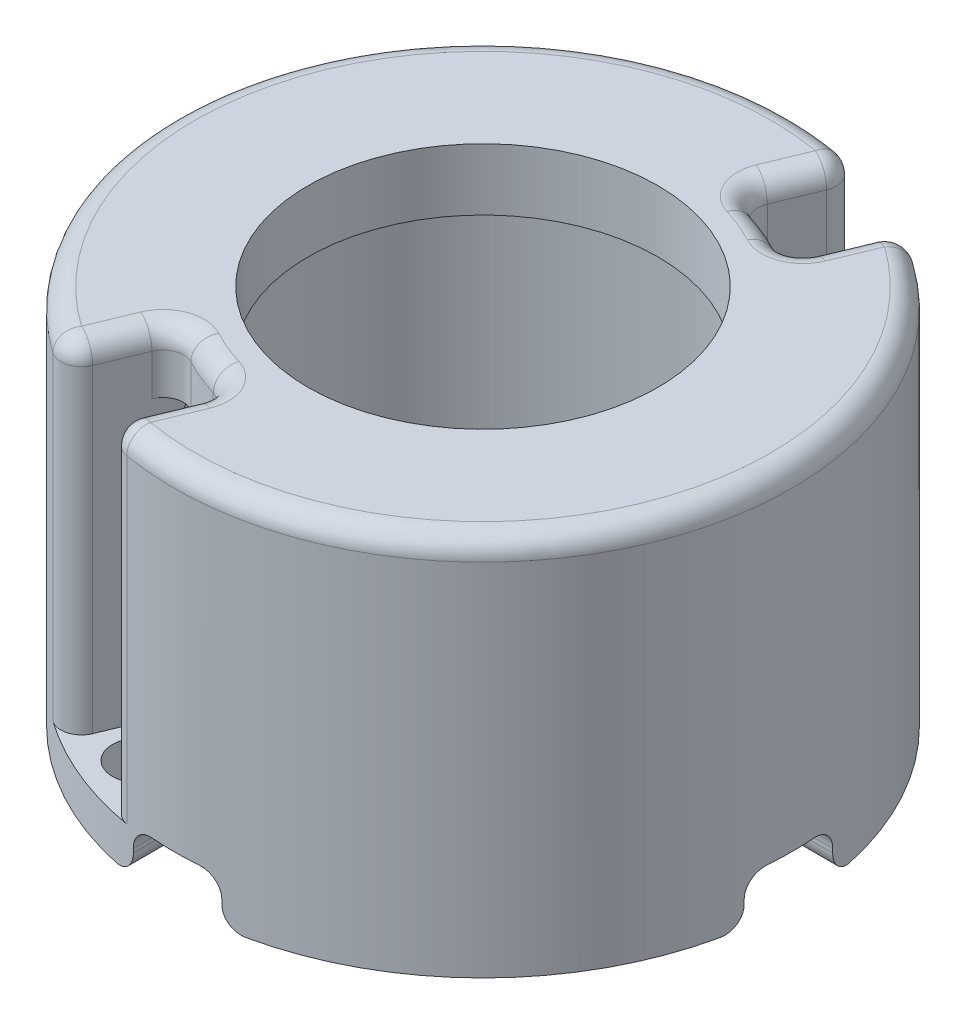
from build123d import *

# Parameters (mm, degrees)
SKETCH1_R                = 15
SKETCH1_R_2              = 10.5
BOSS_EXTRUDE1_DEPTH      = 18.5
CUT_EXTRUDE3_REACH       = 30.147
SKETCH6_R                = 1.35
SKETCH6_3_R              = 1.35
CUT_EXTRUDE4_DEPTH       = 16.5
BOSS_EXTRUDE2_START      = -3
SKETCH7_R                = 10.5
SKETCH7_R_2              = 8.5
BOSS_EXTRUDE2_DEPTH      = 3
FILLET1_R                = 1
CIRPATTERN3_START        = 2
CIRPATTERN3_DEPTH        = 16.5
CIRPATTERN3_2_OUTLINE_R  = 1.35
CIRPATTERN3_2_DEPTH      = 2
FILLET4_R                = 1
FILLET2_R                = 1
CUT_EXTRUDE5_DEPTH       = 2.2
FILLET3_R                = 1
CIRPATTERN2_COUNT        = 4
FILLET3_OF_CIRPATTERN2_R = 1
FILLET5_R                = 1


# Read off the part's stored shape, not the designer's step: CirPattern3
with BuildPart() as part:
    # Sketch1 → Boss-Extrude1 (new body)
    with BuildSketch(Plane(origin=(0, 0, 0), x_dir=(1, 0, 0), z_dir=(0, 1, 0))):
        with Locations(Location((0, 0, 0), (0, 0, 270))):
            Circle(SKETCH1_R)
        with Locations(Location((0, 0, 0), (0, 0, 270))):
            Circle(SKETCH1_R_2, mode=Mode.SUBTRACT)
    extrude(amount=BOSS_EXTRUDE1_DEPTH)

    # Sketch6 → Cut-Extrude3 (cut, up to next)
    with BuildSketch(Plane(origin=(0, 18.5, 0), x_dir=(1, 0, 0), z_dir=(0, 1, 0)), mode=Mode.PRIVATE) as cut_extrude3_sk1:
        with Locations(Location((4.879213763, 11.77946404, 0), (0, 0, 270))):
            Circle(SKETCH6_R)
    cut_extrude3_tool1 = extrude(cut_extrude3_sk1.sketch, amount=-CUT_EXTRUDE3_REACH, mode=Mode.PRIVATE) & part.part
    add(cut_extrude3_tool1.solids().sort_by_distance((4.879214, 18.5, -11.779464))[0], mode=Mode.SUBTRACT)

    # Sketch6<3> → Cut-Extrude4 (cut)
    # profile 1 of 2: a face of its own
    with BuildSketch(Plane(origin=(0, 18.5, 0), x_dir=(1, 0, 0), z_dir=(0, 1, 0))):
        with BuildLine():
            ThreePointArc((6.819360781, 10.975828832), (4.075578555, 9.839317021), (2.939066744, 12.583099247))
            Line((2.939066744, 12.583099247), (1.996845379, 10.308375649))
            Line((1.996845379, 10.308375649), (5.877139416, 8.701105234))
            Line((5.877139416, 8.701105234), (6.819360781, 10.975828832))
        make_face()
    # profile 2 of 2: a face of its own
    with BuildSketch(Plane(origin=(0, 18.5, 0), x_dir=(1, 0, 0), z_dir=(0, 1, 0))):
        with BuildLine():
            Line((3.800104467, 14.661828196), (2.939066744, 12.583099247))
            ThreePointArc((2.939066744, 12.583099247), (4.075578555, 9.839317021), (6.819360781, 10.975828832))
            Line((6.819360781, 10.975828832), (7.680398504, 13.05455778))
            Line((7.680398504, 13.05455778), (3.800104467, 14.661828196))
        make_face()
        with Locations(Location((4.879213763, 11.77946404, 0), (0, 0, 270))):
            Circle(SKETCH6_3_R, mode=Mode.SUBTRACT)
    extrude(amount=-CUT_EXTRUDE4_DEPTH, mode=Mode.SUBTRACT)

    # Sketch7 → Boss-Extrude2 (add)
    with BuildSketch(Plane(origin=(0, 18.5, 0), x_dir=(1, 0, 0), z_dir=(0, 1, 0)).offset(BOSS_EXTRUDE2_START)):
        with Locations(Location((0, 0, 0), (0, 0, 79.036959033))):
            Circle(SKETCH7_R)
        with Locations(Location((0, 0, 0), (0, 0, 270))):
            Circle(SKETCH7_R_2, mode=Mode.SUBTRACT)
    extrude(amount=BOSS_EXTRUDE2_DEPTH)

    # Fillet1
    fillet1_edges = [part.edges().sort_by_distance(p)[0] for p in [
        (3.743571621, 10.25, -14.525345831),
        (7.623865657, 10.25, -12.918075415),
        (5.877139416, 17, -8.701105234),
        (1.996845379, 17, -10.308375649),
    ]]
    fillet(fillet1_edges, radius=FILLET1_R)

    # CirPattern3 outline → CirPattern3 (cut)
    with BuildSketch(Plane(origin=(0, 0, 0), x_dir=(1, 0, 0), z_dir=(0, 1, 0)).offset(CIRPATTERN3_START)):
        with BuildLine():
            ThreePointArc((-1.996845379, -10.308375649), (-4.01817604, -9.700735091), (-5.877139416, -8.701105234))
            Line((-5.877139416, -8.701105234), (-7.16472198, -11.809604521))
            ThreePointArc((-7.16472198, -11.809604521), (-7.811227781, -12.387683189), (-8.666358763, -12.243129738))
            ThreePointArc((-8.666358763, -12.243129738), (-5.740251485, -13.858192988), (-2.529159011, -14.785241111))
            ThreePointArc((-2.529159011, -14.785241111), (-3.236042653, -14.282786919), (-3.284427943, -13.416874937))
            Line((-3.284427943, -13.416874937), (-1.996845379, -10.308375649))
        make_face()
    extrude(amount=CIRPATTERN3_DEPTH, mode=Mode.SUBTRACT)

    # CirPattern3 2 outline → CirPattern3 2 (cut)
    with BuildSketch(Plane(origin=(0, 0, 0), x_dir=(1, 0, 0), z_dir=(0, 1, 0))):
        with Locations((-4.879213763, -11.77946404)):
            Circle(CIRPATTERN3_2_OUTLINE_R)
    extrude(amount=CIRPATTERN3_2_DEPTH, mode=Mode.SUBTRACT)

    # Fillet4
    fillet4_edges = [part.edges().sort_by_distance(p)[0] for p in [
        (-5.877139416, 17, 8.701105234),
        (-1.996845379, 17, 10.308375649),
    ]]
    fillet(fillet4_edges, radius=FILLET4_R)

    # Fillet2
    fillet2_edges = [part.edges().sort_by_distance(p)[0] for p in [
        (14.294176193, 18.5, 4.547144924),
        (-3.236042653, 18.5, 14.282786919),
        (-7.811227781, 18.5, 12.387683189),
        (-4.01817604, 18.5, 9.700735091),
        (-2.862480829, 18.5, 12.398204493),
        (-6.742774866, 18.5, 10.790934077),
        (-2.459916629, 18.5, 10.570369824),
        (-5.734956453, 18.5, 9.213803913),
        (4.01817604, 18.5, -9.700735091),
        (2.86248083, 18.5, -12.398204493),
        (6.742774866, 18.5, -10.790934077),
        (-13.858192988, 18.5, -5.740251486),
        (3.236042653, 18.5, -14.28278692),
        (7.811227781, 18.5, -12.387683189),
        (2.45991663, 18.5, -10.570369825),
        (5.734956453, 18.5, -9.213803913),
    ]]
    fillet(fillet2_edges, radius=FILLET2_R)

    # Sketch8 → Cut-Extrude5 (cut)
    with BuildSketch(Plane.XZ):
        with BuildLine():
            Line((-2.15, 12.75), (-2.15, 15))
            Line((-2.15, 15), (2.15, 15))
            Line((2.15, 15), (2.15, 12.75))
            ThreePointArc((2.15, 12.75), (0, 10.6), (-2.15, 12.75))
        make_face()
    cut_extrude5 = extrude(amount=-CUT_EXTRUDE5_DEPTH, mode=Mode.SUBTRACT)

    # Fillet3
    # the kernel refuses this fillet: 1 mm, written as the material it adds along each edge
    with BuildSketch(Plane(origin=(-2.15, 2.2, 12.75), x_dir=(1, 0, 0), z_dir=(0, 0, 1))) as fillet3_piece_1_section:
        with BuildLine():
            CenterArc((FILLET3_R, -FILLET3_R), FILLET3_R, 90, 90)
            Line((0, -FILLET3_R), (0, 0))
            Line((0, 0), (FILLET3_R, 0))
        make_face()
    fillet3_piece_1 = extrude(amount=4.595117042, mode=Mode.PRIVATE)
    fillet3_piece_1 = fillet3_piece_1 & Plane(origin=(0, 1.975216442, 0), x_dir=(0, 0, 1), z_dir=(0, -1, 0)) * Cylinder(15, 14, mode=Mode.PRIVATE)
    add(fillet3_piece_1)
    with BuildSketch(Plane(origin=(2.15, 2.2, 17.345117042), x_dir=(-1, 0, 0), z_dir=(0, 0, -1))) as fillet3_piece_2_section:
        with BuildLine():
            CenterArc((FILLET3_R, -FILLET3_R), FILLET3_R, 90, 90)
            Line((0, -FILLET3_R), (0, 0))
            Line((0, 0), (FILLET3_R, 0))
        make_face()
    fillet3_piece_2 = extrude(amount=4.595117042, mode=Mode.PRIVATE)
    fillet3_piece_2 = fillet3_piece_2 & Plane(origin=(0, 1.975216442, 0), x_dir=(0, 0, 1), z_dir=(0, -1, 0)) * Cylinder(15, 14, mode=Mode.PRIVATE)
    add(fillet3_piece_2)
    with BuildSketch(Plane(origin=(0, 2.2, 12.75), x_dir=(1, 0, 0), z_dir=(0, 0, 1))) as fillet3_piece_3:
        with BuildLine():
            CenterArc((2.15 - FILLET3_R, -FILLET3_R), FILLET3_R, 0, 90)
            Line((2.15, -FILLET3_R), (2.15, 0))
            Line((2.15, 0), (2.15 - FILLET3_R, 0))
        make_face()
    revolve(axis=Axis((0, 2.2, 12.75), (0, 1, 0)), revolution_arc=180)
    # the kernel refuses this fillet: 1 mm, written as the material it takes off along each edge
    with BuildSketch(Plane(origin=(-2.15, 0, 12.75), x_dir=(-1, 0, 0), z_dir=(0, 0, 1))) as fillet3_2_piece_1:
        with BuildLine():
            CenterArc((FILLET3_R, -FILLET3_R), FILLET3_R, 90, 90)
            Line((0, -FILLET3_R), (0, 0))
            Line((0, 0), (FILLET3_R, 0))
        make_face()
    extrude(amount=4.595117042, mode=Mode.SUBTRACT)
    with BuildSketch(Plane(origin=(2.15, 0, 17.345117042), x_dir=(0, 1, 0), z_dir=(0, 0, -1))) as fillet3_2_piece_2:
        with BuildLine():
            CenterArc((FILLET3_R, FILLET3_R), FILLET3_R, 180, 90)
            Line((0, FILLET3_R), (0, 0))
            Line((0, 0), (FILLET3_R, 0))
        make_face()
    extrude(amount=4.595117042, mode=Mode.SUBTRACT)
    with BuildSketch(Plane(origin=(0, 0, 12.75), x_dir=(1, 0, 0), z_dir=(0, 0, 1))) as fillet3_2_piece_3:
        with BuildLine():
            CenterArc((2.15 + FILLET3_R, FILLET3_R), FILLET3_R, 180, 90)
            Line((2.15, FILLET3_R), (2.15, 0))
            Line((2.15, 0), (2.15 + FILLET3_R, 0))
        make_face()
    revolve(axis=Axis((0, 0, 12.75), (0, 1, 0)), revolution_arc=180, mode=Mode.SUBTRACT)

    # CirPattern2: Cut-Extrude5 ×4 about axis
    cirpattern2_axis = Axis((0, 0, 0), (0, 1, 0))
    for i in range(1, CIRPATTERN2_COUNT):
        add(cut_extrude5.rotate(cirpattern2_axis, i * 360 / CIRPATTERN2_COUNT), mode=Mode.SUBTRACT)

    # Fillet3 of CirPattern2
    # the kernel refuses this fillet: 1 mm, written as the material it adds along each edge
    with BuildSketch(Plane(origin=(12.75, 2.2, 2.15), x_dir=(0, -1, 0), z_dir=(1, 0, 0))) as fillet3_of_cirpattern2_piece_1_section:
        with BuildLine():
            CenterArc((FILLET3_OF_CIRPATTERN2_R, FILLET3_OF_CIRPATTERN2_R), FILLET3_OF_CIRPATTERN2_R, 180, 90)
            Line((0, FILLET3_OF_CIRPATTERN2_R), (0, 0))
            Line((0, 0), (FILLET3_OF_CIRPATTERN2_R, 0))
        make_face()
    fillet3_of_cirpattern2_piece_1 = extrude(amount=4.595117042, mode=Mode.PRIVATE)
    fillet3_of_cirpattern2_piece_1 = fillet3_of_cirpattern2_piece_1 & Plane(origin=(0, 1.975216412, 0), x_dir=(0, 0, 1), z_dir=(0, -1, 0)) * Cylinder(15, 14, mode=Mode.PRIVATE)
    add(fillet3_of_cirpattern2_piece_1)
    with BuildSketch(Plane(origin=(17.345117042, 2.2, -2.15), x_dir=(0, 0, 1), z_dir=(-1, 0, 0))) as fillet3_of_cirpattern2_piece_2_section:
        with BuildLine():
            CenterArc((FILLET3_OF_CIRPATTERN2_R, -FILLET3_OF_CIRPATTERN2_R), FILLET3_OF_CIRPATTERN2_R, 90, 90)
            Line((0, -FILLET3_OF_CIRPATTERN2_R), (0, 0))
            Line((0, 0), (FILLET3_OF_CIRPATTERN2_R, 0))
        make_face()
    fillet3_of_cirpattern2_piece_2 = extrude(amount=4.595117042, mode=Mode.PRIVATE)
    fillet3_of_cirpattern2_piece_2 = fillet3_of_cirpattern2_piece_2 & Plane(origin=(0, 1.975216442, 0), x_dir=(0, 0, 1), z_dir=(0, -1, 0)) * Cylinder(15, 14, mode=Mode.PRIVATE)
    add(fillet3_of_cirpattern2_piece_2)
    with BuildSketch(Plane(origin=(12.75, 2.2, 0), x_dir=(0, 0, -1), z_dir=(1, 0, 0))) as fillet3_of_cirpattern2_piece_3:
        with BuildLine():
            CenterArc((2.15 - FILLET3_OF_CIRPATTERN2_R, -FILLET3_OF_CIRPATTERN2_R), FILLET3_OF_CIRPATTERN2_R, 0, 90)
            Line((2.15 - FILLET3_OF_CIRPATTERN2_R, 0), (2.15, 0))
            Line((2.15, 0), (2.15, -FILLET3_OF_CIRPATTERN2_R))
        make_face()
    revolve(axis=Axis((12.75, 2.2, 0), (0, 1, 0)), revolution_arc=180)
    with BuildSketch(Plane(origin=(2.15, 2.2, -12.75), x_dir=(0, -1, 0), z_dir=(0, 0, -1))) as fillet3_of_cirpattern2_piece_4_section:
        with BuildLine():
            CenterArc((FILLET3_OF_CIRPATTERN2_R, FILLET3_OF_CIRPATTERN2_R), FILLET3_OF_CIRPATTERN2_R, 180, 90)
            Line((0, FILLET3_OF_CIRPATTERN2_R), (0, 0))
            Line((0, 0), (FILLET3_OF_CIRPATTERN2_R, 0))
        make_face()
    fillet3_of_cirpattern2_piece_4 = extrude(amount=4.595117042, mode=Mode.PRIVATE)
    fillet3_of_cirpattern2_piece_4 = fillet3_of_cirpattern2_piece_4 & Plane(origin=(0, 1.975216412, 0), x_dir=(0, 0, 1), z_dir=(0, -1, 0)) * Cylinder(15, 14, mode=Mode.PRIVATE)
    add(fillet3_of_cirpattern2_piece_4)
    with BuildSketch(Plane(origin=(-2.15, 2.2, -17.345117042), x_dir=(1, 0, 0), z_dir=(0, 0, 1))) as fillet3_of_cirpattern2_piece_5_section:
        with BuildLine():
            CenterArc((FILLET3_OF_CIRPATTERN2_R, -FILLET3_OF_CIRPATTERN2_R), FILLET3_OF_CIRPATTERN2_R, 90, 90)
            Line((0, -FILLET3_OF_CIRPATTERN2_R), (0, 0))
            Line((0, 0), (FILLET3_OF_CIRPATTERN2_R, 0))
        make_face()
    fillet3_of_cirpattern2_piece_5 = extrude(amount=4.595117042, mode=Mode.PRIVATE)
    fillet3_of_cirpattern2_piece_5 = fillet3_of_cirpattern2_piece_5 & Plane(origin=(0, 1.975216442, 0), x_dir=(0, 0, 1), z_dir=(0, -1, 0)) * Cylinder(15, 14, mode=Mode.PRIVATE)
    add(fillet3_of_cirpattern2_piece_5)
    with BuildSketch(Plane(origin=(0, 2.2, -12.75), x_dir=(-1, 0, 0), z_dir=(0, 0, -1))) as fillet3_of_cirpattern2_piece_6:
        with BuildLine():
            CenterArc((2.15 - FILLET3_OF_CIRPATTERN2_R, -FILLET3_OF_CIRPATTERN2_R), FILLET3_OF_CIRPATTERN2_R, 0, 90)
            Line((2.15 - FILLET3_OF_CIRPATTERN2_R, 0), (2.15, 0))
            Line((2.15, 0), (2.15, -FILLET3_OF_CIRPATTERN2_R))
        make_face()
    revolve(axis=Axis((0, 2.2, -12.75), (0, 1, 0)), revolution_arc=180)
    with BuildSketch(Plane(origin=(-12.75, 2.2, -2.15), x_dir=(0, -1, 0), z_dir=(-1, 0, 0))) as fillet3_of_cirpattern2_piece_7_section:
        with BuildLine():
            CenterArc((FILLET3_OF_CIRPATTERN2_R, FILLET3_OF_CIRPATTERN2_R), FILLET3_OF_CIRPATTERN2_R, 180, 90)
            Line((0, FILLET3_OF_CIRPATTERN2_R), (0, 0))
            Line((0, 0), (FILLET3_OF_CIRPATTERN2_R, 0))
        make_face()
    fillet3_of_cirpattern2_piece_7 = extrude(amount=4.595117042, mode=Mode.PRIVATE)
    fillet3_of_cirpattern2_piece_7 = fillet3_of_cirpattern2_piece_7 & Plane(origin=(0, 1.975216578, 0), x_dir=(0, 0, 1), z_dir=(0, -1, 0)) * Cylinder(15, 14, mode=Mode.PRIVATE)
    add(fillet3_of_cirpattern2_piece_7)
    with BuildSketch(Plane(origin=(-17.345117042, 2.2, 2.15), x_dir=(0, 0, -1), z_dir=(1, 0, 0))) as fillet3_of_cirpattern2_piece_8_section:
        with BuildLine():
            CenterArc((FILLET3_OF_CIRPATTERN2_R, -FILLET3_OF_CIRPATTERN2_R), FILLET3_OF_CIRPATTERN2_R, 90, 90)
            Line((0, -FILLET3_OF_CIRPATTERN2_R), (0, 0))
            Line((0, 0), (FILLET3_OF_CIRPATTERN2_R, 0))
        make_face()
    fillet3_of_cirpattern2_piece_8 = extrude(amount=4.595117042, mode=Mode.PRIVATE)
    fillet3_of_cirpattern2_piece_8 = fillet3_of_cirpattern2_piece_8 & Plane(origin=(0, 1.975216442, 0), x_dir=(0, 0, 1), z_dir=(0, -1, 0)) * Cylinder(15, 14, mode=Mode.PRIVATE)
    add(fillet3_of_cirpattern2_piece_8)
    with BuildSketch(Plane(origin=(-12.75, 2.2, 0), x_dir=(0, 0, 1), z_dir=(-1, 0, 0))) as fillet3_of_cirpattern2_piece_9:
        with BuildLine():
            CenterArc((2.15 - FILLET3_OF_CIRPATTERN2_R, -FILLET3_OF_CIRPATTERN2_R), FILLET3_OF_CIRPATTERN2_R, 0, 90)
            Line((2.15 - FILLET3_OF_CIRPATTERN2_R, 0), (2.15, 0))
            Line((2.15, 0), (2.15, -FILLET3_OF_CIRPATTERN2_R))
        make_face()
    revolve(axis=Axis((-12.75, 2.2, 0), (0, 1, 0)), revolution_arc=180)
    # the kernel refuses this fillet: 1 mm, written as the material it takes off along each edge
    with BuildSketch(Plane(origin=(12.75, 0, 2.15), x_dir=(0, 0, 1), z_dir=(1, 0, 0)), Plane(origin=(17.345117042, 0, -2.15), x_dir=(0, 0, -1), z_dir=(-1, 0, 0)), Plane(origin=(2.15, 0, -12.75), x_dir=(1, 0, 0), z_dir=(0, 0, -1)), Plane(origin=(-2.15, 0, -17.345117042), x_dir=(-1, 0, 0), z_dir=(0, 0, 1)), Plane(origin=(-12.75, 0, -2.15), x_dir=(0, 0, -1), z_dir=(-1, 0, 0)), Plane(origin=(-17.345117042, 0, 2.15), x_dir=(0, 0, 1), z_dir=(1, 0, 0))) as fillet3_of_cirpattern2_2_piece_1:
        with BuildLine():
            CenterArc((FILLET3_OF_CIRPATTERN2_R, -FILLET3_OF_CIRPATTERN2_R), FILLET3_OF_CIRPATTERN2_R, 90, 90)
            Line((0, -FILLET3_OF_CIRPATTERN2_R), (0, 0))
            Line((0, 0), (FILLET3_OF_CIRPATTERN2_R, 0))
        make_face()
    extrude(amount=4.595117042, mode=Mode.SUBTRACT)
    with BuildSketch(Plane(origin=(12.75, 0, 0), x_dir=(0, 0, -1), z_dir=(1, 0, 0))) as fillet3_of_cirpattern2_2_piece_2:
        with BuildLine():
            CenterArc((2.15 + FILLET3_OF_CIRPATTERN2_R, FILLET3_OF_CIRPATTERN2_R), FILLET3_OF_CIRPATTERN2_R, 180, 90)
            Line((2.15, FILLET3_OF_CIRPATTERN2_R), (2.15, 0))
            Line((2.15, 0), (2.15 + FILLET3_OF_CIRPATTERN2_R, 0))
        make_face()
    revolve(axis=Axis((12.75, 0, 0), (0, 1, 0)), revolution_arc=180, mode=Mode.SUBTRACT)
    with BuildSketch(Plane(origin=(0, 0, -12.75), x_dir=(-1, 0, 0), z_dir=(0, 0, -1))) as fillet3_of_cirpattern2_2_piece_3:
        with BuildLine():
            CenterArc((2.15 + FILLET3_OF_CIRPATTERN2_R, FILLET3_OF_CIRPATTERN2_R), FILLET3_OF_CIRPATTERN2_R, 180, 90)
            Line((2.15, FILLET3_OF_CIRPATTERN2_R), (2.15, 0))
            Line((2.15, 0), (2.15 + FILLET3_OF_CIRPATTERN2_R, 0))
        make_face()
    revolve(axis=Axis((0, 0, -12.75), (0, 1, 0)), revolution_arc=180, mode=Mode.SUBTRACT)
    with BuildSketch(Plane(origin=(-12.75, 0, 0), x_dir=(0, 0, 1), z_dir=(-1, 0, 0))) as fillet3_of_cirpattern2_2_piece_4:
        with BuildLine():
            CenterArc((2.15 + FILLET3_OF_CIRPATTERN2_R, FILLET3_OF_CIRPATTERN2_R), FILLET3_OF_CIRPATTERN2_R, 180, 90)
            Line((2.15, FILLET3_OF_CIRPATTERN2_R), (2.15, 0))
            Line((2.15, 0), (2.15 + FILLET3_OF_CIRPATTERN2_R, 0))
        make_face()
    revolve(axis=Axis((-12.75, 0, 0), (0, 1, 0)), revolution_arc=180, mode=Mode.SUBTRACT)

    # Fillet5
    # the kernel refuses this fillet: 1 mm, written as the material it adds along each edge
    with BuildSketch(Plane(origin=(0, 15.5, 0), x_dir=(0.4166229549583832, 0, -0.9090793768432683), z_dir=(0.9090793768432683, 0, 0.4166229549583832))) as fillet5_piece_1_section:
        with BuildLine():
            CenterArc((10.5 - FILLET5_R, -FILLET5_R), FILLET5_R, 0, 90)
            Line((10.5 - FILLET5_R, 0), (10.5 - FILLET5_R, FILLET5_R * 0.02))
            Line((10.5 - FILLET5_R, FILLET5_R * 0.02), (10.5 + FILLET5_R * 0.02, FILLET5_R * 0.02))
            Line((10.5 + FILLET5_R * 0.02, FILLET5_R * 0.02), (10.5 + FILLET5_R * 0.02, -FILLET5_R))
            Line((10.5 + FILLET5_R * 0.02, -FILLET5_R), (10.5, -FILLET5_R))
        make_face()
    fillet5_piece_1 = revolve(axis=Axis((0, 15.5, 0), (0, 1, 0)), revolution_arc=184.243126683, mode=Mode.PRIVATE)
    fillet5_piece_1 = split(fillet5_piece_1, bisect_by=Plane(origin=(-1.940147016, 15.220730238, -0.803635208), z_dir=(-0.9238795324379931, 0, -0.38268343254203624)), keep=Keep.TOP, mode=Mode.PRIVATE)
    add(fillet5_piece_1)
    with BuildSketch(Plane(origin=(0, 15.5, 0), x_dir=(0, 0, 1), z_dir=(-1, 0, 0))) as fillet5_piece_2_section:
        with BuildLine():
            CenterArc((10.5 - FILLET5_R, -FILLET5_R), FILLET5_R, 0, 90)
            Line((10.5 - FILLET5_R, 0), (10.5 - FILLET5_R, FILLET5_R * 0.02))
            Line((10.5 - FILLET5_R, FILLET5_R * 0.02), (10.5 + FILLET5_R * 0.02, FILLET5_R * 0.02))
            Line((10.5 + FILLET5_R * 0.02, FILLET5_R * 0.02), (10.5 + FILLET5_R * 0.02, -FILLET5_R))
            Line((10.5 + FILLET5_R * 0.02, -FILLET5_R), (10.5, -FILLET5_R))
        make_face()
    fillet5_piece_2 = revolve(axis=Axis((0, 15.5, 0), (0, 1, 0)), revolution_arc=159.619313851, mode=Mode.PRIVATE)
    fillet5_piece_2 = split(fillet5_piece_2, bisect_by=Plane(origin=(2.313761556, 15.220412059, -0.098350076), z_dir=(0.9238795325112864, 0, 0.3826834323650906)), keep=Keep.TOP, mode=Mode.PRIVATE)
    add(fillet5_piece_2)
    with BuildSketch(Plane(origin=(0, 15.5, 0), x_dir=(-0.41635973218057093, 0, 0.9091999633845809), z_dir=(-0.9091999633845809, 0, -0.41635973218057093))) as fillet5_piece_3_section:
        with BuildLine():
            CenterArc((10.5 - FILLET5_R, -FILLET5_R), FILLET5_R, 0, 90)
            Line((10.5 - FILLET5_R, 0), (10.5 - FILLET5_R, FILLET5_R * 0.02))
            Line((10.5 - FILLET5_R, FILLET5_R * 0.02), (10.5 + FILLET5_R * 0.02, FILLET5_R * 0.02))
            Line((10.5 + FILLET5_R * 0.02, FILLET5_R * 0.02), (10.5 + FILLET5_R * 0.02, -FILLET5_R))
            Line((10.5 + FILLET5_R * 0.02, -FILLET5_R), (10.5, -FILLET5_R))
        make_face()
    fillet5_piece_3 = revolve(axis=Axis((0, 15.5, 0), (0, 1, 0)), revolution_arc=24.604974521, mode=Mode.PRIVATE)
    fillet5_piece_3 = split(fillet5_piece_3, bisect_by=Plane(origin=(-1.814757654, 15.267944463, 9.868776995), z_dir=(0.9238795324815187, 0, 0.38268343243695646)), keep=Keep.TOP, mode=Mode.PRIVATE)
    add(fillet5_piece_3)


solid = part.part
